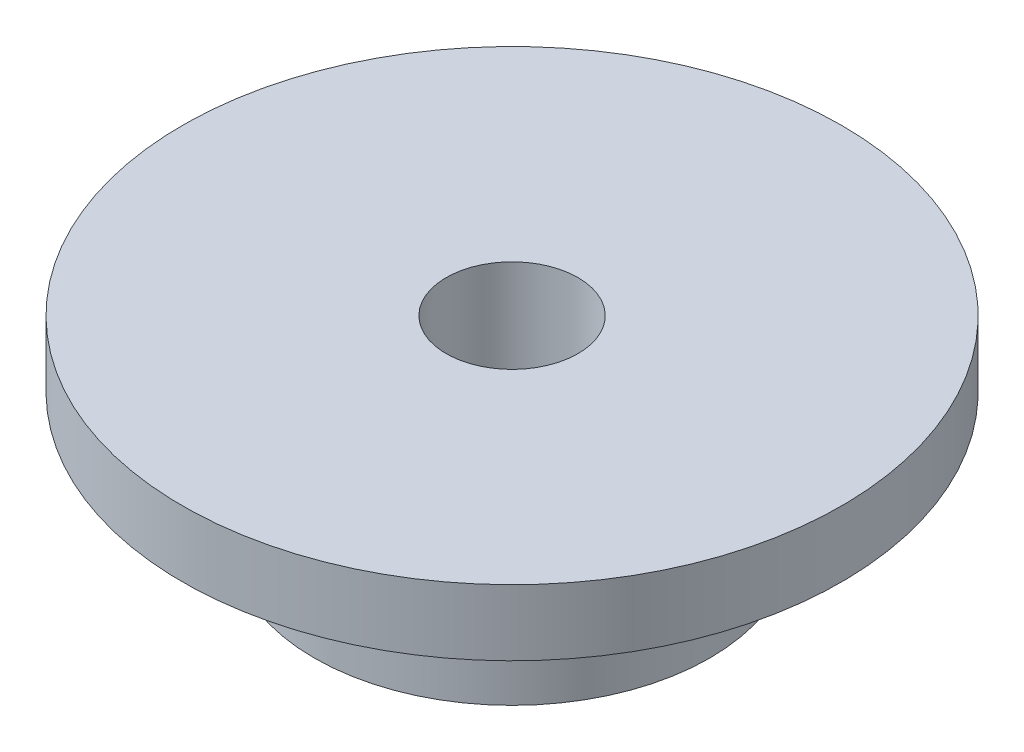
from build123d import *


with BuildPart() as part:
    # Эскиз1 → Повернуть1 (revolve)
    with BuildSketch(Plane.XY):
        Polygon((2, -0.353980743), (2, 5.646019257), (10, 5.646019257), (10, 3.646019257), (6, 3.646019257), (6, -0.353980743), align=None)
    revolve(axis=Axis((0, 0, 0), (0, 1, 0)))


solid = part.part
